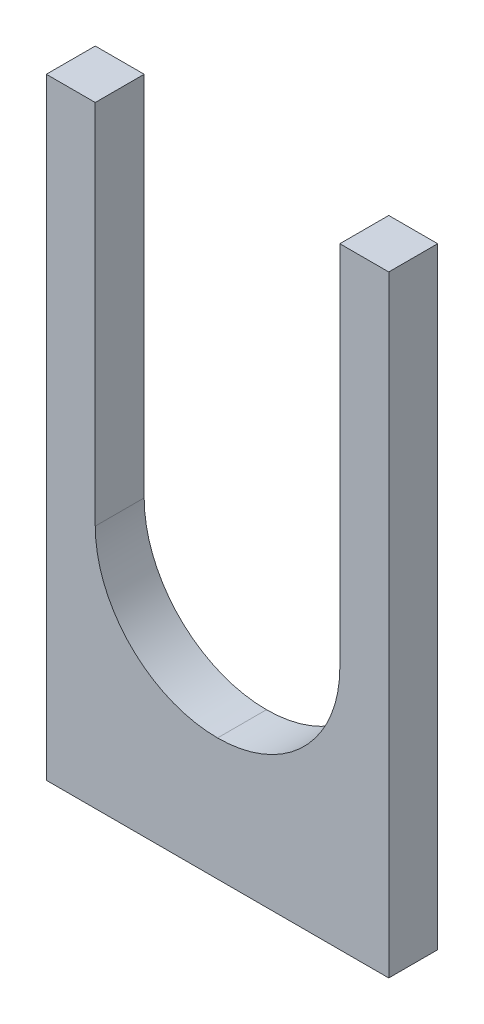
from build123d import *

# Parameters (mm, degrees)
BOSS_EXTRUDE1_DEPTH = 10
FILLET1_R           = 25


with BuildPart() as part:
    # Sketch1 → Boss-Extrude1 (new body)
    with BuildSketch(Plane.XY):
        Polygon((35, -75), (35, 50), (25, 50), (25, -50), (-25, -50), (-25, 50), (-35, 50), (-35, -75), align=None)
    extrude(amount=BOSS_EXTRUDE1_DEPTH)

    # Fillet1
    fillet1_edges = [part.edges().sort_by_distance(p)[0] for p in [
        (25, -50, 5),
        (-25, -50, 5),
    ]]
    fillet(fillet1_edges, radius=FILLET1_R - 0.0001)  # a hair under: the kernel refuses the full size


solid = part.part
